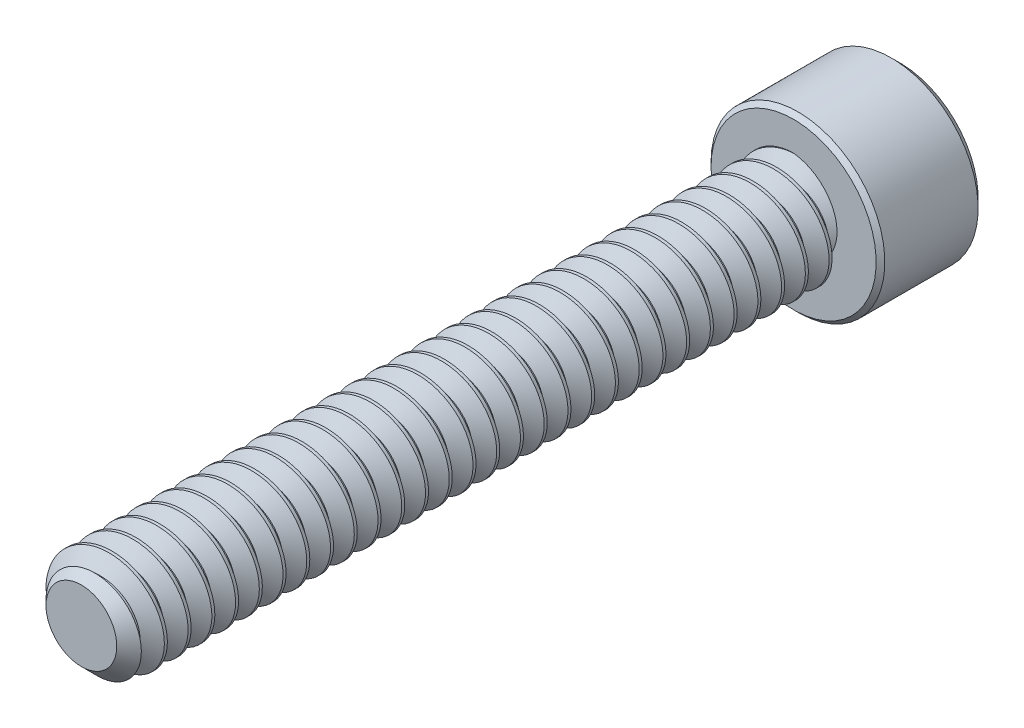
from build123d import *

# Parameters (mm, degrees)
SKETCH1_R          = 1.4224
EXTRUDE1_DEPTH     = 19.05
CHAMFER3_SIZE      = 0.47625
CUT_SWEEP1_PITCH   = 0.635
SKETCH6_R          = 2.3241
EXTRUDE2_DEPTH     = 2.8448
CUT_EXTRUDE1_DEPTH = 1.7859375
CHAMFER1_SIZE      = 0.23241
CHAMFER2_SIZE      = 0.116205


with BuildPart() as part:
    # Sketch1 → Extrude1 (new body)
    with BuildSketch(Plane.XY):
        Circle(SKETCH1_R)
    extrude(amount=-EXTRUDE1_DEPTH)

    # Chamfer3
    chamfer3_edges = [part.edges().sort_by_distance(p)[0] for p in [
        (-1.4224, 0, 0),
    ]]
    chamfer(chamfer3_edges, length=CHAMFER3_SIZE)

    # Cut-Sweep1: arcs per turn and ends read off the stored shape
    # Cut-Sweep1: the profile of Sketch3 profile screwed along a right-hand helix through 32 turns, 6 arcs to a turn; built about Z, then put on its axis
    cut_sweep1_z = Axis((0, 0, 0), (0, 0, 1))
    cut_sweep1_corners = [(1.4227, 0, -0.555798205), (1.009955401, 0, -0.3175), (1.009955401, 0, -0.238125), (1.4227, 0, 0.000173205)]
    with BuildLine(mode=Mode.PRIVATE) as cut_sweep1_profile:
        Line(cut_sweep1_corners[0], cut_sweep1_corners[1])
        Line(cut_sweep1_corners[1], cut_sweep1_corners[2])
        Line(cut_sweep1_corners[2], cut_sweep1_corners[3])
        Line(cut_sweep1_corners[3], cut_sweep1_corners[0])
    cut_sweep1_cap = Face(cut_sweep1_profile.wire())
    cut_sweep1_turn_angles = [0, 30, 60, 90, 120, 150, 180, 210, 240, 270, 300, 330, 360]
    cut_sweep1_turn_weights = [1, 0.8660254037844387, 1, 0.8660254037844387, 1, 0.8660254037844387, 1, 0.8660254037844387, 1, 0.8660254037844387, 1, 0.8660254037844387, 1]
    cut_sweep1_turn_rails = [Edge.make_bspline([Vector(p[0], p[1], 0).rotate(cut_sweep1_z, cut_sweep1_turn_angles[k]) / cut_sweep1_turn_weights[k] + Vector(0, 0, p[2] + CUT_SWEEP1_PITCH * cut_sweep1_turn_angles[k] / 360) for k in range(13)], [0, 0, 0, 1, 1, 2, 2, 3, 3, 4, 4, 5, 5, 6, 6, 6], 2, cut_sweep1_turn_weights) for p in cut_sweep1_corners]
    cut_sweep1_turn_sides = [Face.make_surface_from_curves(cut_sweep1_turn_rails[p[0]], cut_sweep1_turn_rails[p[1]]) for p in [(0, 1), (1, 2), (2, 3), (3, 0)]]
    cut_sweep1 = Plane(origin=(0, 0, 0), x_dir=(0, 1, 0), z_dir=(0, 0, -1)) * Solid(Shell([*[p.moved(Location((0, 0, CUT_SWEEP1_PITCH * i))) for i in range(32) for p in cut_sweep1_turn_sides], cut_sweep1_cap, cut_sweep1_cap.rotate(cut_sweep1_z, 11520).moved(Location((0, 0, CUT_SWEEP1_PITCH * 11520 / 360)))]))
    add(cut_sweep1, mode=Mode.SUBTRACT)

    # Sketch6 → Extrude2 (add)
    with BuildSketch(Plane(origin=(0, 0, -19.05), x_dir=(-1, 0, 0), z_dir=(0, 0, -1))):
        Circle(SKETCH6_R)
    extrude(amount=EXTRUDE2_DEPTH)

    # Sketch7 → Cut-Extrude1 (cut)
    with BuildSketch(Plane(origin=(0, 0, -21.8948), x_dir=(-1, 0, 0), z_dir=(0, 0, -1))):
        Polygon((0, 1.374815329), (-1.190625, 0.687407664), (-1.190625, -0.687407664), (0, -1.374815329), (1.190625, -0.687407664), (1.190625, 0.687407664), align=None)
    extrude(amount=-CUT_EXTRUDE1_DEPTH, mode=Mode.SUBTRACT)

    # Cut-Extrude2 cone 1 section (through the dimple's axis) → Cut-Extrude2 (revolve, cut)
    with BuildSketch(Plane(origin=(0, 0, -21.8948), x_dir=(0, 1, 0), z_dir=(1, 0, 0))):
        Polygon((0, 0), (1.374815329, 0), (0, 1.374815329), align=None)
    revolve(axis=Axis((0, 0, -21.8948), (0, 0, 1)), mode=Mode.SUBTRACT)

    # Chamfer1
    chamfer1_edges = [part.edges().sort_by_distance(p)[0] for p in [
        (2.3241, 0, -21.8948),
    ]]
    chamfer(chamfer1_edges, length=CHAMFER1_SIZE)

    # Chamfer2
    chamfer2_edges = [part.edges().sort_by_distance(p)[0] for p in [
        (2.3241, 0, -19.05),
    ]]
    chamfer(chamfer2_edges, length=CHAMFER2_SIZE)


solid = part.part
